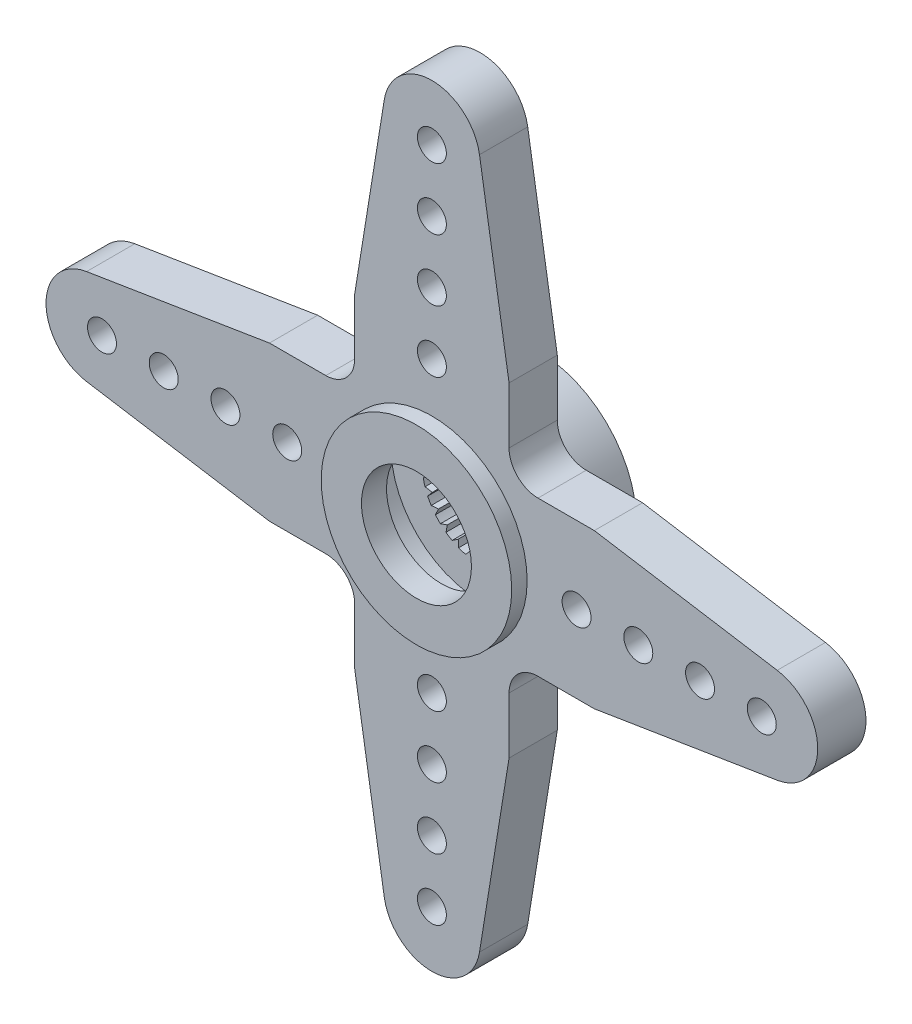
from build123d import *

# Parameters (mm, degrees)
BOSS_EXTRUDE1_DEPTH        = 2.5
M8_CLEARANCE_HOLE1_D       = 9.25
SKETCH4_R                  = 4.937986177
BOSS_EXTRUDE2_DEPTH        = 1.3
SKETCH5_R                  = 5.099596851
BOSS_EXTRUDE3_DEPTH        = 3
CUT_EXTRUDE1_DEPTH         = 3.6
F_1_5_1_5_DIAMETER_HOLE1_D = 1.5
FILLET1_R                  = 1.5


with BuildPart() as part:
    # Sketch1 → Boss-Extrude1 (new body)
    with BuildSketch(Plane.XY.offset(2.5)):
        with BuildLine():
            Line((4, -8.419183588), (4, -4))
            Line((4, -4), (8.419183588, -4))
            Line((8.419183588, -4), (17.898853189, -2.467978147))
            ThreePointArc((17.898853189, -2.467978147), (20, 0), (17.898853189, 2.467978147))
            Line((17.898853189, 2.467978147), (8.419183588, 4))
            Line((8.419183588, 4), (4, 4))
            Line((4, 4), (4, 8.419183588))
            Line((4, 8.419183588), (2.467978147, 17.898853189))
            ThreePointArc((2.467978147, 17.898853189), (0, 20), (-2.467978147, 17.898853189))
            Line((-2.467978147, 17.898853189), (-4, 8.419183588))
            Line((-4, 8.419183588), (-4, 4))
            Line((-4, 4), (-8.419183588, 4))
            Line((-8.419183588, 4), (-17.898853189, 2.467978147))
            ThreePointArc((-17.898853189, 2.467978147), (-20, 0), (-17.898853189, -2.467978147))
            Line((-17.898853189, -2.467978147), (-8.419183588, -4))
            Line((-8.419183588, -4), (-4, -4))
            Line((-4, -4), (-4, -8.419183588))
            Line((-4, -8.419183588), (-2.467978147, -17.898853189))
            ThreePointArc((-2.467978147, -17.898853189), (0, -20), (2.467978147, -17.898853189))
            Line((2.467978147, -17.898853189), (4, -8.419183588))
        make_face()
    extrude(amount=-BOSS_EXTRUDE1_DEPTH)

    # M8 Clearance Hole1 (through all)
    with Locations(Plane.XY.offset(2.5)):
        with Locations((0, 0)):
            Hole(M8_CLEARANCE_HOLE1_D / 2)

    # Sketch4 → Boss-Extrude2 (add)
    with BuildSketch(Plane(origin=(0, 0, 2), x_dir=(-1, 0, 0), z_dir=(0, 0, -1))):
        Circle(SKETCH4_R)
    extrude(amount=-BOSS_EXTRUDE2_DEPTH)

    # Sketch5 → Boss-Extrude3 (add)
    with BuildSketch(Plane.XY):
        Circle(SKETCH5_R)
    extrude(amount=-BOSS_EXTRUDE3_DEPTH)

    # Sketch6 → Cut-Extrude1 (cut)
    with BuildSketch(Plane(origin=(0, 0, -3), x_dir=(-1, 0, 0), z_dir=(0, 0, -1))):
        with BuildLine():
            Line((-2.994554723, 0.180671), (-2.667483, 0))
            Line((-2.667483, 0), (-2.993563417, -0.196413))
            ThreePointArc((-2.993563417, -0.196413), (-2.975345367, -0.383822804), (-2.94540633, -0.569720588))
            Line((-2.94540633, -0.569720588), (-2.583679116, -0.663376046))
            Line((-2.583679116, -0.663376046), (-2.850669191, -0.934711273))
            ThreePointArc((-2.850669191, -0.934711273), (-2.786416572, -1.111702609), (-2.711187226, -1.284314536))
            Line((-2.711187226, -1.284314536), (-2.337533172, -1.285069736))
            Line((-2.337533172, -1.285069736), (-2.528656935, -1.614278199))
            ThreePointArc((-2.528656935, -1.614278199), (-2.422406975, -1.76973005), (-2.306614256, -1.918210278))
            Line((-2.306614256, -1.918210278), (-1.944511421, -1.826017768))
            Line((-1.944511421, -1.826017768), (-2.047759865, -2.192414089))
            ThreePointArc((-2.047759865, -2.192414089), (-1.906188639, -2.316558843), (-1.75710823, -2.431577814))
            Line((-1.75710823, -2.431577814), (-1.429308867, -2.252230388))
            Line((-1.429308867, -2.252230388), (-1.438194511, -2.632792538))
            ThreePointArc((-1.438194511, -2.632792538), (-1.27019746, -2.717829725), (-1.097196632, -2.792160373))
            Line((-1.097196632, -2.792160373), (-0.824297579, -2.536927089))
            Line((-0.824297579, -2.536927089), (-0.738262106, -2.90774295))
            ThreePointArc((-0.738262106, -2.90774295), (-0.554395104, -2.948329369), (-0.368344134, -2.977301227))
            Line((-0.368344134, -2.977301227), (-0.167492643, -2.662219332))
            Line((-0.167492643, -2.662219332), (0.008058022, -2.999989178))
            ThreePointArc((0.008058022, -2.999989178), (0.196241936, -2.993574636), (0.383652781, -2.975367296))
            Line((0.383652781, -2.975367296), (0.499836471, -2.620234542))
            Line((0.499836471, -2.620234542), (0.753871834, -2.903735053))
            ThreePointArc((0.753871834, -2.903735053), (0.934548373, -2.850722599), (1.11154338, -2.786480094))
            Line((1.11154338, -2.786480094), (1.135759022, -2.41361078))
            Line((1.135759022, -2.41361078), (1.452317107, -2.625028575))
            ThreePointArc((1.452317107, -2.625028575), (1.614133699, -2.528749177), (1.769591621, -2.4225081))
            Line((1.769591621, -2.4225081), (1.700317656, -2.055330976))
            Line((1.700317656, -2.055330976), (2.059507955, -2.181381898))
            ThreePointArc((2.059507955, -2.181381898), (2.192297068, -2.047885144), (2.316449912, -1.906321013))
            Line((2.316449912, -1.906321013), (2.158039079, -1.567907168))
            Line((2.158039079, -1.567907168), (2.537292343, -1.600670974))
            ThreePointArc((2.537292343, -1.600670974), (2.63271035, -1.438344956), (2.717757136, -1.270352765))
            Line((2.717757136, -1.270352765), (2.48016297, -0.981965986))
            Line((2.48016297, -0.981965986), (2.855649322, -0.919384005))
            ThreePointArc((2.855649322, -0.919384005), (2.907700758, -0.738428265), (2.948297684, -0.554563582))
            Line((2.948297684, -0.554563582), (2.6464491, -0.33432427))
            Line((2.6464491, -0.33432427), (2.994575352, -0.180328758))
            ThreePointArc((2.994575352, -0.180328758), (2.999989634, 0.007886591), (2.993585845, 0.196070871))
            Line((2.993585845, 0.196070871), (2.6464491, 0.33432427))
            Line((2.6464491, 0.33432427), (2.945341199, 0.570057208))
            ThreePointArc((2.945341199, 0.570057208), (2.903778127, 0.753705902), (2.850775998, 0.93438547))
            Line((2.850775998, 0.93438547), (2.48016297, 0.981965986))
            Line((2.48016297, 0.981965986), (2.711040427, 1.284624383))
            ThreePointArc((2.711040427, 1.284624383), (2.625111562, 1.4521671), (2.528841411, 1.613989194))
            Line((2.528841411, 1.613989194), (2.158039079, 1.567907168))
            Line((2.158039079, 1.567907168), (2.306395014, 1.918473883))
            ThreePointArc((2.306395014, 1.918473883), (2.181499583, 2.059383299), (2.048010417, 2.192180041))
            Line((2.048010417, 2.192180041), (1.700317656, 2.055330976))
            Line((1.700317656, 2.055330976), (1.756830319, 2.431778614))
            ThreePointArc((1.756830319, 2.431778614), (1.600815962, 2.53720087), (1.438495397, 2.632628153))
            Line((1.438495397, 2.632628153), (1.135759022, 2.41361078))
            Line((1.135759022, 2.41361078), (1.096877515, 2.792285751))
            ThreePointArc((1.096877515, 2.792285751), (0.919547186, 2.85559678), (0.73859442, 2.907658557))
            Line((0.73859442, 2.907658557), (0.499836471, 2.620234542))
            Line((0.499836471, 2.620234542), (0.368003863, 2.977343305))
            ThreePointArc((0.368003863, 2.977343305), (0.180499879, 2.994565042), (-0.00771516, 2.999990079))
            Line((-0.00771516, 2.999990079), (-0.167492643, 2.662219332))
            Line((-0.167492643, 2.662219332), (-0.383992826, 2.975323429))
            ThreePointArc((-0.383992826, 2.975323429), (-0.569888899, 2.94537377), (-0.753539968, 2.903821192))
            Line((-0.753539968, 2.903821192), (-0.824297579, 2.536927089))
            Line((-0.824297579, 2.536927089), (-1.111861833, 2.78635304))
            ThreePointArc((-1.111861833, 2.78635304), (-1.284469462, 2.711113831), (-1.452017089, 2.62519454))
            Line((-1.452017089, 2.62519454), (-1.429308867, 2.252230388))
            Line((-1.429308867, 2.252230388), (-1.769868472, 2.422305842))
            ThreePointArc((-1.769868472, 2.422305842), (-1.918342084, 2.306504639), (-2.059258636, 2.18161726))
            Line((-2.059258636, 2.18161726), (-1.944511421, 1.826017768))
            Line((-1.944511421, 1.826017768), (-2.316667766, 1.906056259))
            ThreePointArc((-2.316667766, 1.906056259), (-2.431678218, 1.756969278), (-2.53710939, 1.600960944))
            Line((-2.53710939, 1.600960944), (-2.337533172, 1.285069736))
            Line((-2.337533172, 1.285069736), (-2.717902304, 1.270042151))
            ThreePointArc((-2.717902304, 1.270042151), (-2.792223067, 1.097037075), (-2.855544229, 0.919710365))
            Line((-2.855544229, 0.919710365), (-2.583679116, 0.663376046))
            Line((-2.583679116, 0.663376046), (-2.948361045, 0.554226624))
            ThreePointArc((-2.948361045, 0.554226624), (-2.977322271, 0.368173999), (-2.994554723, 0.180671))
        make_face()
    extrude(amount=-CUT_EXTRUDE1_DEPTH, mode=Mode.SUBTRACT)

    # Ø1.5 (1.5) Diameter Hole1 (through all)
    with Locations(Plane(origin=(0, 0, 0), x_dir=(-1, 0, 0), z_dir=(0, 0, -1))):
        with Locations((0, 17.1), (0, 13.9), (0, 10.7), (0, 7.5), (17.1, 0), (13.9, 0), (10.7, 0), (7.5, 0), (-17.1, 0), (-13.9, 0), (-10.7, 0), (-7.5, 0), (0, -17.1), (0, -13.9), (0, -10.7), (0, -7.5)):
            Hole(F_1_5_1_5_DIAMETER_HOLE1_D / 2)

    # Sketch9 → CBORE for M2.5 Hex Head Machine Screw1 (revolve, cut)
    with BuildSketch(Plane(origin=(0, 0, 3.3), x_dir=(0, -1, 0), z_dir=(1, 0, 0))):
        Polygon((0, 0), (0, 1.3), (1.5, 1.3), (1.5, 1.5), (2.85, 1.5), (2.85, 0), align=None)
    revolve(axis=Axis((0, 0, 9.65), (0, 0, -1)), mode=Mode.SUBTRACT)

    # Fillet1
    fillet1_edges = [part.edges().sort_by_distance(p)[0] for p in [
        (4, -4, 1.25),
        (-4, -4, 1.25),
        (-4, 4, 1.25),
        (4, 4, 1.25),
    ]]
    fillet(fillet1_edges, radius=FILLET1_R)


solid = part.part
